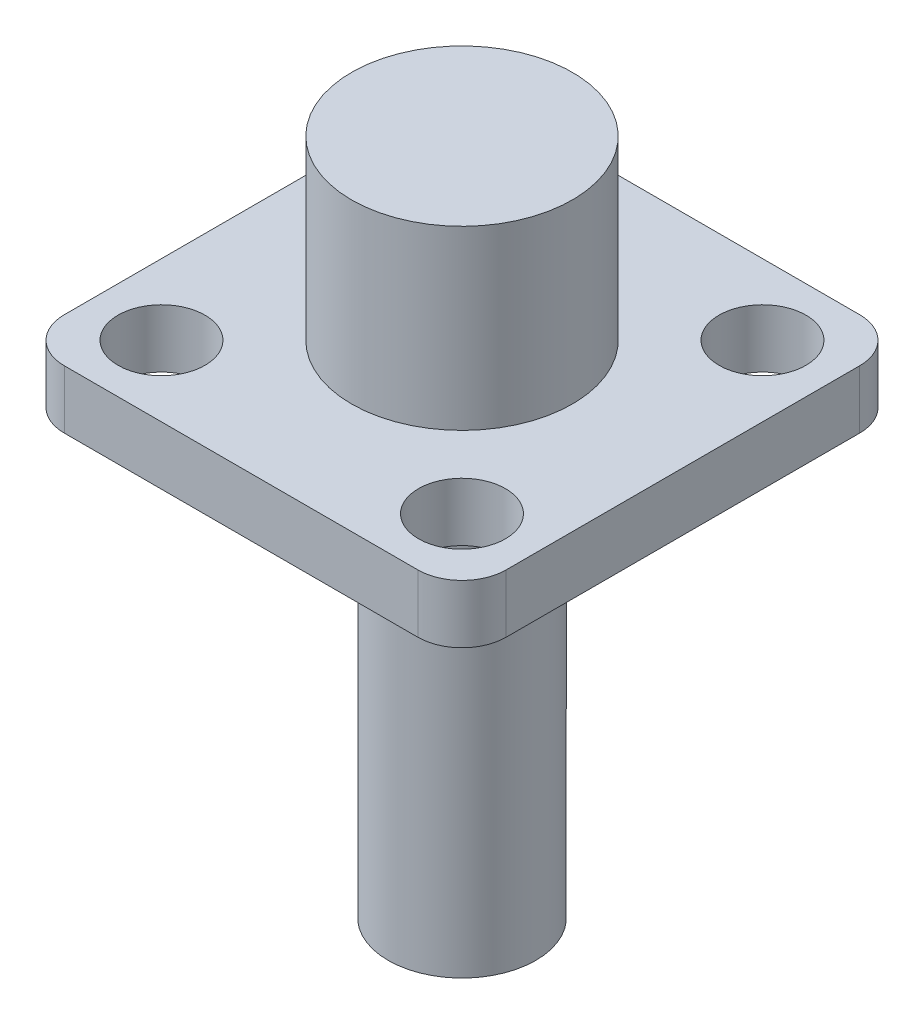
from build123d import *

# Parameters (mm, degrees)
BOSS_EXTRUDE1_DEPTH           = 1.6764
F_2_5MM_DOWEL_HOLE1_OUTLINE_R = 1.25
F_2_5MM_DOWEL_HOLE1_DEPTH     = 1.6764
SKETCH4_R                     = 3.175
BOSS_EXTRUDE2_DEPTH           = 5.08
SKETCH5_R                     = 2.1209
BOSS_EXTRUDE3_DEPTH           = 12.7


# Read off the part's stored shape, not the designer's step: Ø2.5mm Dowel Hole1
with BuildPart() as part:
    # Sketch1 → Boss-Extrude1 (new body)
    with BuildSketch(Plane(origin=(0, 0, 0), x_dir=(1, 0, 0), z_dir=(0, 1, 0))):
        with BuildLine():
            Line((-5.08, -6.35), (5.08, -6.35))
            ThreePointArc((5.08, -6.35), (5.978025612, -5.978025612), (6.35, -5.08))
            Line((6.35, -5.08), (6.35, 5.08))
            ThreePointArc((6.35, 5.08), (5.978025612, 5.978025612), (5.08, 6.35))
            Line((5.08, 6.35), (-5.08, 6.35))
            ThreePointArc((-5.08, 6.35), (-5.978025612, 5.978025612), (-6.35, 5.08))
            Line((-6.35, 5.08), (-6.35, -5.08))
            ThreePointArc((-6.35, -5.08), (-5.978025612, -5.978025612), (-5.08, -6.35))
        make_face()
    extrude(amount=BOSS_EXTRUDE1_DEPTH)

    # Ø2.5mm Dowel Hole1 outline → Ø2.5mm Dowel Hole1 (cut)
    with BuildSketch(Plane(origin=(0, 0, 0), x_dir=(1, 0, 0), z_dir=(0, 1, 0))):
        with Locations((4.318, -4.318)):
            Circle(F_2_5MM_DOWEL_HOLE1_OUTLINE_R)
        with Locations((-4.318, 4.318)):
            Circle(F_2_5MM_DOWEL_HOLE1_OUTLINE_R)
        with Locations((-4.318, -4.318)):
            Circle(F_2_5MM_DOWEL_HOLE1_OUTLINE_R)
        with Locations((4.318, 4.318)):
            Circle(F_2_5MM_DOWEL_HOLE1_OUTLINE_R)
    extrude(amount=F_2_5MM_DOWEL_HOLE1_DEPTH, mode=Mode.SUBTRACT)

    # Sketch4 → Boss-Extrude2 (add)
    with BuildSketch(Plane(origin=(0, 1.6764, 0), x_dir=(1, 0, 0), z_dir=(0, 1, 0))):
        with Locations(Location((0, 0, 0), (0, 0, 270))):
            Circle(SKETCH4_R)
    extrude(amount=BOSS_EXTRUDE2_DEPTH)

    # Sketch5 → Boss-Extrude3 (add)
    with BuildSketch(Plane.XZ):
        with Locations(Location((0, 0, 0), (0, 0, 90))):
            Circle(SKETCH5_R)
    extrude(amount=BOSS_EXTRUDE3_DEPTH)


solid = part.part
